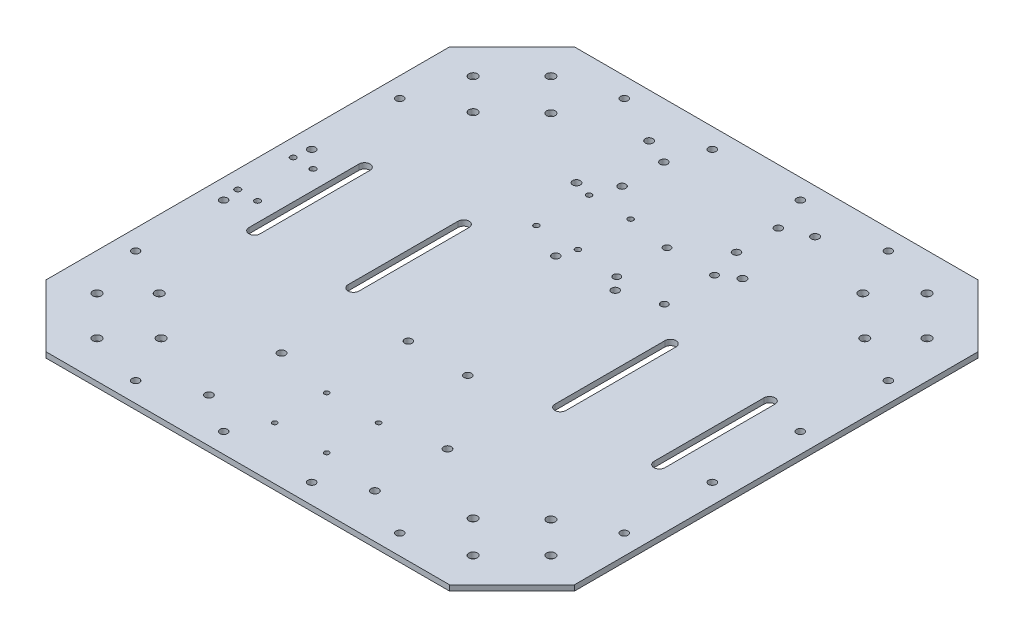
from build123d import *

# Parameters (mm, degrees)
BOSS_EXTRUDE1_DEPTH = 3.175
SKETCH2_R           = 2.4638
CUT_EXTRUDE1_DEPTH  = 6.35
SKETCH3_R           = 2.159
CUT_EXTRUDE2_DEPTH  = 6.35
SKETCH4_R           = 2.2225
CUT_EXTRUDE3_DEPTH  = 351.937720963
SKETCH5_R           = 1.651
CUT_EXTRUDE4_DEPTH  = 351.937720963
SKETCH6_R           = 2.032
SKETCH6_R_2         = 2.159
SKETCH6_R_3         = 1.397
SKETCH6_R_4         = 1.5499969
CUT_EXTRUDE5_DEPTH  = 351.937720963
SKETCH7_R           = 2.159
CUT_EXTRUDE6_DEPTH  = 351.937720963
CUT_EXTRUDE8_DEPTH  = 351.937720963


with BuildPart() as part:
    # Sketch1 → Boss-Extrude1 (new body)
    with BuildSketch(Plane(origin=(0, 0, 0), x_dir=(1, 0, 0), z_dir=(0, 1, 0))):
        Polygon((-25.845025354, 51.656360067), (-61.766049839, 15.735335583), (-61.766049839, -217.222615449), (-25.845025354, -253.143639933), (207.112925677, -253.143639933), (243.033950161, -217.222615449), (243.033950161, 15.735335583), (207.112925677, 51.656360067), align=None)
    extrude(amount=BOSS_EXTRUDE1_DEPTH)

    # Sketch2 → Cut-Extrude1 (cut)
    with BuildSketch(Plane(origin=(0, 3.175, 0), x_dir=(1, 0, 0), z_dir=(0, 1, 0))):
        with Locations((-17.872380726, 30.213331256)):
            Circle(SKETCH2_R)
        with Locations((0.640891541, 11.70005899)):
            Circle(SKETCH2_R)
        with Locations((-22.362508786, -10.197821288)):
            Circle(SKETCH2_R)
        with Locations((-40.323021028, 7.762690954)):
            Circle(SKETCH2_R)
        with Locations((203.630409109, -10.197821288)):
            Circle(SKETCH2_R)
        with Locations((221.590921351, 7.762690954)):
            Circle(SKETCH2_R)
        with Locations((180.627008782, 11.70005899)):
            Circle(SKETCH2_R)
        with Locations((199.140281048, 30.213331256)):
            Circle(SKETCH2_R)
        with Locations((-22.362508786, -191.289458578)):
            Circle(SKETCH2_R)
        with Locations((-40.323021028, -209.24997082)):
            Circle(SKETCH2_R)
        with Locations((-17.872380726, -231.700611123)):
            Circle(SKETCH2_R)
        with Locations((0.640891541, -213.187338857)):
            Circle(SKETCH2_R)
        with Locations((221.590921351, -209.24997082)):
            Circle(SKETCH2_R)
        with Locations((199.140281048, -231.700611123)):
            Circle(SKETCH2_R)
        with Locations((180.627008782, -213.187338857)):
            Circle(SKETCH2_R)
        with Locations((203.630409109, -191.289458578)):
            Circle(SKETCH2_R)
    extrude(amount=-CUT_EXTRUDE1_DEPTH, mode=Mode.SUBTRACT)

    # Sketch3 → Cut-Extrude2 (cut)
    with BuildSketch(Plane(origin=(0, 3.175, 0), x_dir=(1, 0, 0), z_dir=(0, 1, 0))):
        with Locations((73.361950161, -58.198639933)):
            Circle(SKETCH3_R)
        with Locations((107.651950161, -58.198639933)):
            Circle(SKETCH3_R)
        with Locations((73.361950161, -143.288639933)):
            Circle(SKETCH3_R)
        with Locations((107.651950161, -143.288639933)):
            Circle(SKETCH3_R)
    extrude(amount=-CUT_EXTRUDE2_DEPTH, mode=Mode.SUBTRACT)

    # Sketch4 → Cut-Extrude3 (cut, through all)
    with BuildSketch(Plane(origin=(0, 3.175, 0), x_dir=(1, 0, 0), z_dir=(0, 1, 0))):
        with Locations((42.754950161, 26.256360067)):
            Circle(SKETCH4_R)
        with Locations((138.512950161, 26.256360067)):
            Circle(SKETCH4_R)
        with Locations((42.754950161, -15.653639933)):
            Circle(SKETCH4_R)
        with Locations((138.512950161, -15.653639933)):
            Circle(SKETCH4_R)
        with Locations((138.512950161, -185.833639933)):
            Circle(SKETCH4_R)
        with Locations((42.754950161, -185.833639933)):
            Circle(SKETCH4_R)
        with Locations((138.512950161, -227.743639933)):
            Circle(SKETCH4_R)
        with Locations((42.754950161, -227.743639933)):
            Circle(SKETCH4_R)
    extrude(amount=-CUT_EXTRUDE3_DEPTH, mode=Mode.SUBTRACT)

    # Sketch5 → Cut-Extrude4 (cut, through all)
    with BuildSketch(Plane(origin=(0, 3.175, 0), x_dir=(1, 0, 0), z_dir=(0, 1, 0))):
        with Locations((-51.606049839, -84.741639933)):
            Circle(SKETCH5_R)
        with Locations((-40.176049839, -84.741639933)):
            Circle(SKETCH5_R)
        with Locations((-40.176049839, -116.745639933)):
            Circle(SKETCH5_R)
        with Locations((-51.606049839, -116.745639933)):
            Circle(SKETCH5_R)
    extrude(amount=-CUT_EXTRUDE4_DEPTH, mode=Mode.SUBTRACT)

    # Sketch6 → Cut-Extrude5 (cut, through all)
    with BuildSketch(Plane(origin=(0, 3.175, 0), x_dir=(1, 0, 0), z_dir=(0, 1, 0))):
        with Locations((101.301950161, -22.003639933)):
            Circle(SKETCH6_R)
        with Locations((101.301950161, -50.959639933)):
            Circle(SKETCH6_R)
        with Locations((128.733950161, -50.959639933)):
            Circle(SKETCH6_R)
        with Locations((128.733950161, -22.003639933)):
            Circle(SKETCH6_R)
        with Locations((57.613950161, 19.906360067)):
            Circle(SKETCH6_R_2)
        with Locations((57.613950161, -4.223639933)):
            Circle(SKETCH6_R_2)
        with Locations((123.653950161, -4.223639933)):
            Circle(SKETCH6_R_2)
        with Locations((123.653950161, 19.906360067)):
            Circle(SKETCH6_R_2)
        with Locations((75.647950161, -192.691639933)):
            Circle(SKETCH6_R_3)
        with Locations((75.647950161, -222.663639933)):
            Circle(SKETCH6_R_3)
        with Locations((105.619950161, -222.663639933)):
            Circle(SKETCH6_R_3)
        with Locations((105.619950161, -192.691639933)):
            Circle(SKETCH6_R_3)
        with Locations((52.533950161, -18.193639933)):
            Circle(SKETCH6_R_4)
        with Locations((52.533950161, -48.593629933)):
            Circle(SKETCH6_R_4)
        with Locations((76.533952961, -18.193639933)):
            Circle(SKETCH6_R_4)
        with Locations((76.533952961, -48.593629933)):
            Circle(SKETCH6_R_4)
    extrude(amount=-CUT_EXTRUDE5_DEPTH, mode=Mode.SUBTRACT)

    # Sketch7 → Cut-Extrude6 (cut, through all)
    with BuildSketch(Plane(origin=(0, 3.175, 0), x_dir=(1, 0, 0), z_dir=(0, 1, 0))):
        with Locations((65.233950161, 40.226360067)):
            Circle(SKETCH7_R)
        with Locations((14.433950161, 40.226360067)):
            Circle(SKETCH7_R)
        with Locations((-50.336049839, -75.343639933)):
            Circle(SKETCH7_R)
        with Locations((-50.336049839, -24.543639933)):
            Circle(SKETCH7_R)
        with Locations((231.603950161, -24.543639933)):
            Circle(SKETCH7_R)
        with Locations((231.603950161, -75.343639933)):
            Circle(SKETCH7_R)
        with Locations((166.833950161, 40.226360067)):
            Circle(SKETCH7_R)
        with Locations((116.033950161, 40.226360067)):
            Circle(SKETCH7_R)
        with Locations((116.033950161, -241.713639933)):
            Circle(SKETCH7_R)
        with Locations((166.833950161, -241.713639933)):
            Circle(SKETCH7_R)
        with Locations((231.603950161, -126.143639933)):
            Circle(SKETCH7_R)
        with Locations((231.603950161, -176.943639933)):
            Circle(SKETCH7_R)
        with Locations((-50.336049839, -176.943639933)):
            Circle(SKETCH7_R)
        with Locations((-50.336049839, -126.143639933)):
            Circle(SKETCH7_R)
        with Locations((14.433950161, -241.713639933)):
            Circle(SKETCH7_R)
        with Locations((65.233950161, -241.713639933)):
            Circle(SKETCH7_R)
    extrude(amount=-CUT_EXTRUDE6_DEPTH, mode=Mode.SUBTRACT)

    # Sketch8 → Cut-Extrude8 (cut, through all)
    with BuildSketch(Plane(origin=(0, 3.175, 0), x_dir=(1, 0, 0), z_dir=(0, 1, 0))):
        with BuildLine():
            Line((-23.031049839, -68.993639933), (-23.031049839, -132.493639933))
            ThreePointArc((-23.031049839, -132.493639933), (-26.206049839, -135.668639933), (-29.381049839, -132.493639933))
            Line((-29.381049839, -132.493639933), (-29.381049839, -68.993639933))
            ThreePointArc((-29.381049839, -68.993639933), (-26.206049839, -65.818639933), (-23.031049839, -68.993639933))
        make_face()
        with BuildLine():
            Line((34.118950161, -68.993639933), (34.118950161, -132.493639933))
            ThreePointArc((34.118950161, -132.493639933), (30.943950161, -135.668639933), (27.768950161, -132.493639933))
            Line((27.768950161, -132.493639933), (27.768950161, -68.993639933))
            ThreePointArc((27.768950161, -68.993639933), (30.943950161, -65.818639933), (34.118950161, -68.993639933))
        make_face()
        with BuildLine():
            Line((204.298950161, -68.993639933), (204.298950161, -132.493639933))
            ThreePointArc((204.298950161, -132.493639933), (207.473950161, -135.668639933), (210.648950161, -132.493639933))
            Line((210.648950161, -132.493639933), (210.648950161, -68.993639933))
            ThreePointArc((210.648950161, -68.993639933), (207.473950161, -65.818639933), (204.298950161, -68.993639933))
        make_face()
        with BuildLine():
            Line((147.148950161, -68.993639933), (147.148950161, -132.493639933))
            ThreePointArc((147.148950161, -132.493639933), (150.323950161, -135.668639933), (153.498950161, -132.493639933))
            Line((153.498950161, -132.493639933), (153.498950161, -68.993639933))
            ThreePointArc((153.498950161, -68.993639933), (150.323950161, -65.818639933), (147.148950161, -68.993639933))
        make_face()
    extrude(amount=-CUT_EXTRUDE8_DEPTH, mode=Mode.SUBTRACT)


solid = part.part
